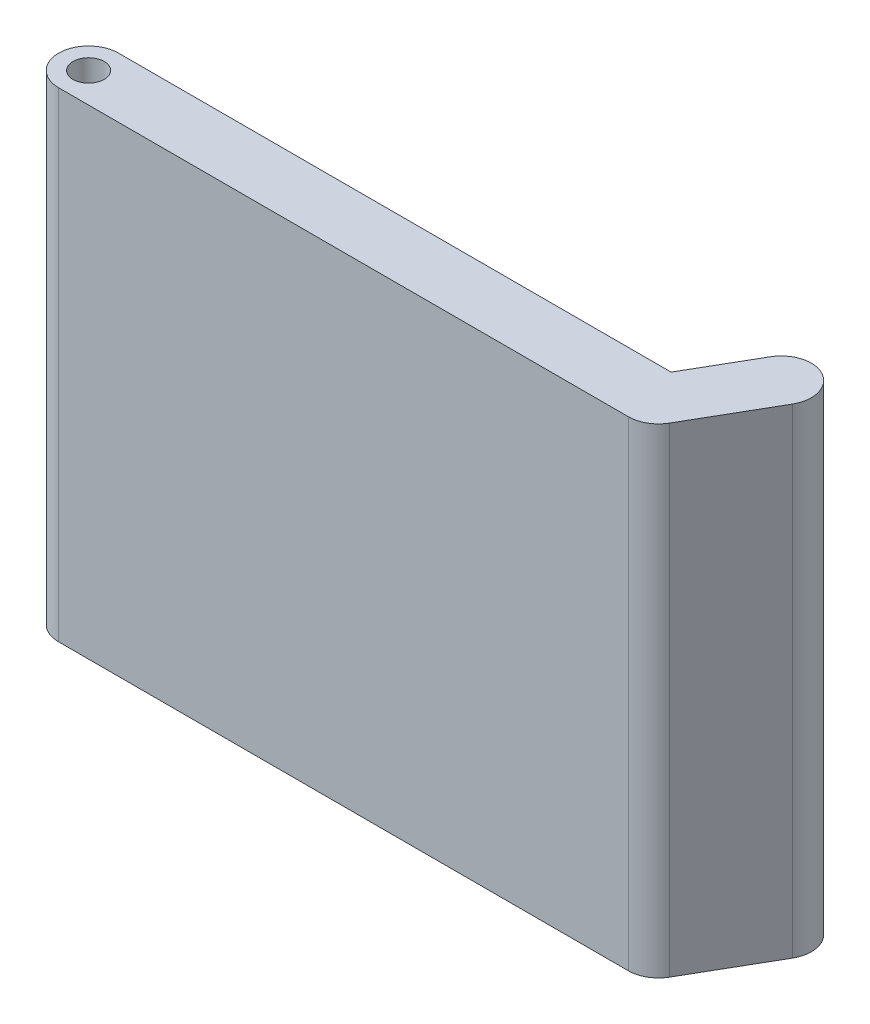
from build123d import *

# Parameters (mm, degrees)
SKETCH1_R           = 3.302
BOSS_EXTRUDE1_DEPTH = 101.6


with BuildPart() as part:
    # Sketch1 → Boss-Extrude1 (new body)
    with BuildSketch(Plane(origin=(0, 0, 0), x_dir=(1, 0, 0), z_dir=(0, 1, 0))):
        with BuildLine():
            Line((116.983825791, 6.35), (0, 6.35))
            ThreePointArc((0, 6.35), (-6.35, 0), (0, -6.35))
            Line((0, -6.35), (120.65, -6.35))
            ThreePointArc((120.65, -6.35), (123.825, -5.499261314), (126.149261314, -3.175))
            Line((126.149261314, -3.175), (135.674261314, 13.322783942))
            ThreePointArc((135.674261314, 13.322783942), (133.35, 21.997045256), (124.675738686, 19.672783942))
            Line((124.675738686, 19.672783942), (116.983825791, 6.35))
        make_face()
        Circle(SKETCH1_R, mode=Mode.SUBTRACT)
    extrude(amount=BOSS_EXTRUDE1_DEPTH)


solid = part.part
